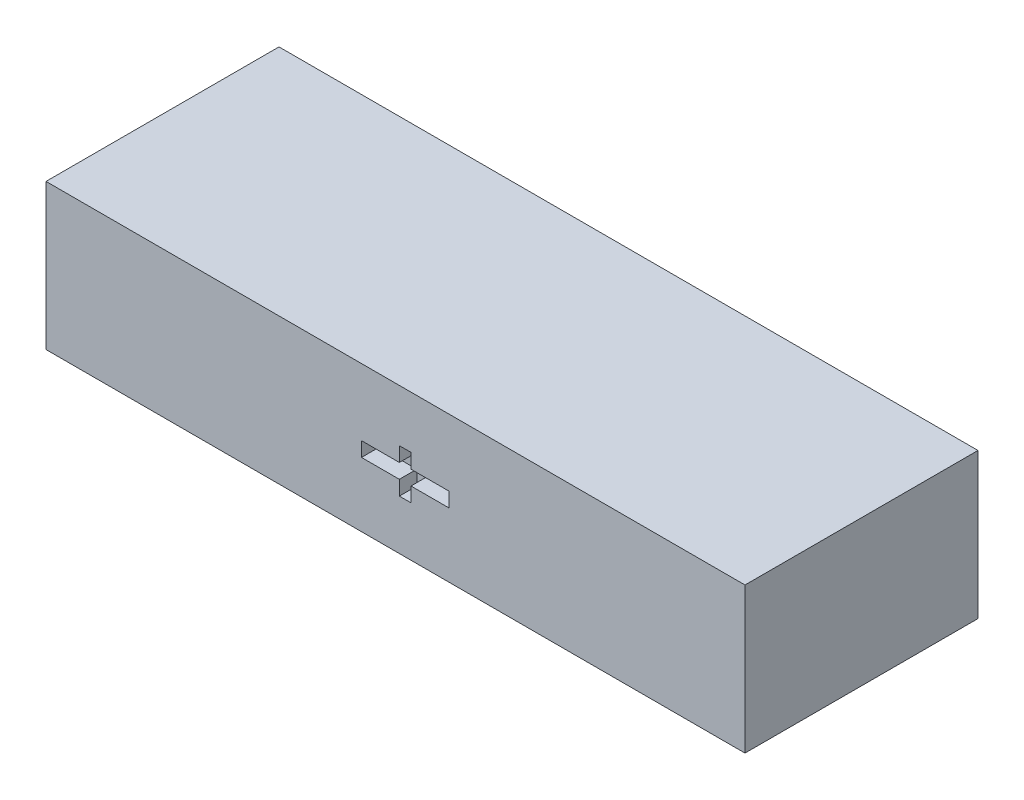
from build123d import *

# Parameters (mm, degrees)
SKETCH1_W           = 240
SKETCH1_H           = 80
BOSS_EXTRUDE1_DEPTH = 50
SKETCH2_W           = 41
SKETCH2_H           = 21
CUT_EXTRUDE1_DEPTH  = 45
CUT_EXTRUDE2_DEPTH  = 6


with BuildPart() as part:
    # Sketch1 → Boss-Extrude1 (new body)
    with BuildSketch(Plane(origin=(0, 0, 0), x_dir=(1, 0, 0), z_dir=(0, 1, 0))):
        with Locations((120, 40)):
            Rectangle(SKETCH1_W, SKETCH1_H)
    extrude(amount=BOSS_EXTRUDE1_DEPTH)

    # Sketch2 → Cut-Extrude1 (cut)
    with BuildSketch(Plane(origin=(0, 0, 0), x_dir=(1, 0, 0), z_dir=(0, 1, 0))):
        with Locations((180, 40)):
            Rectangle(SKETCH2_W, SKETCH2_H)
    extrude(amount=CUT_EXTRUDE1_DEPTH, mode=Mode.SUBTRACT)

    # Sketch3 → Cut-Extrude2 (cut)
    with BuildSketch(Plane.XY):
        Polygon((138.320268524, 24.58409494), (138.320268524, 27.08409494), (125.320268524, 27.08409494), (125.320268524, 32.08409494), (121.320268524, 32.08409494), (121.320268524, 27.08409494), (108.320268524, 27.08409494), (108.320268524, 24.58409494), (108.320268524, 22.08409494), (121.320268524, 22.08409494), (121.320268524, 17.08409494), (125.320268524, 17.08409494), (125.320268524, 22.08409494), (138.320268524, 22.08409494), align=None)
    extrude(amount=-CUT_EXTRUDE2_DEPTH, mode=Mode.SUBTRACT)


solid = part.part
